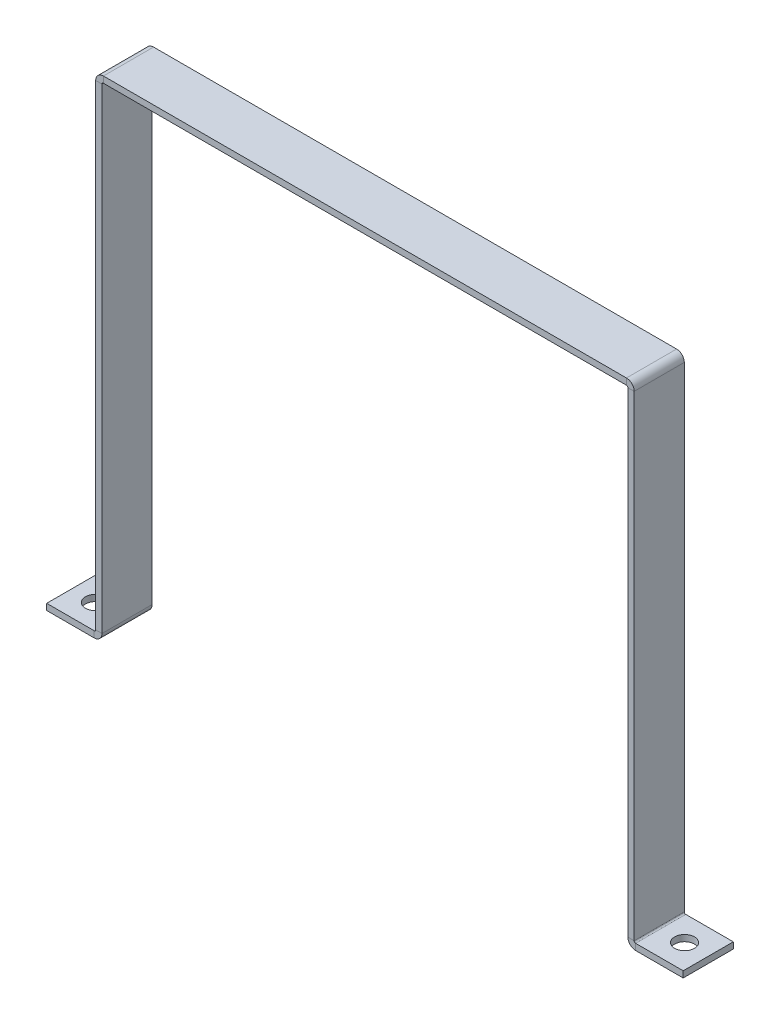
from build123d import *

# Parameters (mm, degrees)
CROQUIS1_W                    = 265
CROQUIS1_H                    = 3.175
BRIDA_BASE1_DEPTH             = 25.4
BRIDA_DE_ARISTA1_DEPTH        = 25.4
BRIDA_DE_ARISTA1_BEND_DEPTH   = 25.4
BRIDA_DE_ARISTA2_DEPTH        = 25.4
BRIDA_DE_ARISTA2_BEND_DEPTH   = 25.4
TALADRO_DE_MARGEN_PARA_3_81_D = 10.0838


# Sheet-metal steps are written as plain solids
with BuildPart() as part:
    # Croquis1 → Brida base1 (new body)
    with BuildSketch(Plane.XY):
        with Locations((56.420112782, -1.5875)):
            Rectangle(CROQUIS1_W, CROQUIS1_H)
    extrude(amount=BRIDA_BASE1_DEPTH)

    # Brida de arista1 section (across the edge) → Brida de arista1 (add)
    with BuildSketch(Plane(origin=(189.656712782, -3.175, 0), x_dir=(-1, 0, 0), z_dir=(0, 0, 1))):
        with BuildLine():
            Line((-3.175, 0.7366), (-3.175, 241.825))
            Line((-3.175, 241.825), (0, 241.825))
            Line((0, 241.825), (0, 0.7366))
            ThreePointArc((0, 0.7366), (0.215745145, 0.215745145), (0.7366, 0))
            Line((0.7366, 0), (0.7366, -3.175))
            ThreePointArc((0.7366, -3.175), (-2.029318885, -2.029318885), (-3.175, 0.7366))
        make_face()
    extrude(amount=BRIDA_DE_ARISTA1_DEPTH)

    # Brida de arista1 section 2 (across the edge) → Brida de arista1 bend (add)
    with BuildSketch(Plane(origin=(-76.816487218, -3.175, 25.4), x_dir=(1, 0, 0), z_dir=(0, 0, -1))):
        with BuildLine():
            Line((-3.175, 0.7366), (-3.175, 241.825))
            Line((-3.175, 241.825), (0, 241.825))
            Line((0, 241.825), (0, 0.7366))
            ThreePointArc((0, 0.7366), (0.215745145, 0.215745145), (0.7366, 0))
            Line((0.7366, 0), (0.7366, -3.175))
            ThreePointArc((0.7366, -3.175), (-2.029318885, -2.029318885), (-3.175, 0.7366))
        make_face()
    extrude(amount=BRIDA_DE_ARISTA1_BEND_DEPTH)

    # Brida de arista2 section (across the edge) → Brida de arista2 (add)
    with BuildSketch(Plane(origin=(192.831712782, -245.7366, 25.4), x_dir=(0, 1, 0), z_dir=(0, 0, -1))):
        with BuildLine():
            Line((-3.175, 0.7366), (-3.175, 24.825))
            Line((-3.175, 24.825), (0, 24.825))
            Line((0, 24.825), (0, 0.7366))
            ThreePointArc((0, 0.7366), (0.215745145, 0.215745145), (0.7366, 0))
            Line((0.7366, 0), (0.7366, -3.175))
            ThreePointArc((0.7366, -3.175), (-2.029318885, -2.029318885), (-3.175, 0.7366))
        make_face()
    extrude(amount=BRIDA_DE_ARISTA2_DEPTH)

    # Brida de arista2 section 2 (across the edge) → Brida de arista2 bend (add)
    with BuildSketch(Plane(origin=(-79.991487218, -245.7366, 0), x_dir=(0, 1, 0), z_dir=(0, 0, 1))):
        with BuildLine():
            Line((-3.175, 0.7366), (-3.175, 24.825))
            Line((-3.175, 24.825), (0, 24.825))
            Line((0, 24.825), (0, 0.7366))
            ThreePointArc((0, 0.7366), (0.215745145, 0.215745145), (0.7366, 0))
            Line((0.7366, 0), (0.7366, -3.175))
            ThreePointArc((0.7366, -3.175), (-2.029318885, -2.029318885), (-3.175, 0.7366))
        make_face()
    extrude(amount=BRIDA_DE_ARISTA2_BEND_DEPTH)

    # Taladro de margen para 3/81 (through all)
    with Locations(Plane(origin=(0, -248.9116, 0), x_dir=(-1, 0, 0), z_dir=(0, -1, 0))):
        with Locations((92.816487218, -12.7), (-205.656712782, -12.7)):
            Hole(TALADRO_DE_MARGEN_PARA_3_81_D / 2)


solid = part.part
